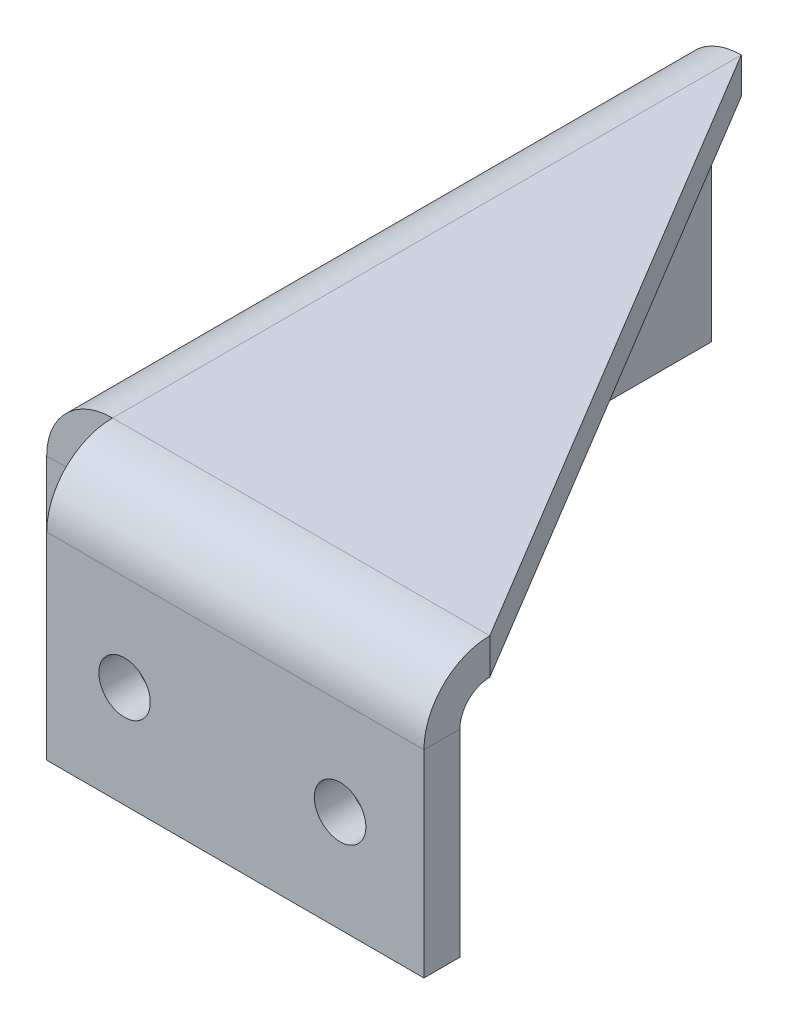
from build123d import *

# Parameters (mm, degrees)
SKETCH1_W            = 31.5
SKETCH1_H            = 52.5
BASE_FLANGE1_DEPTH   = 3
EDGE_FLANGE1_DEPTH   = 31.5
EDGE_FLANGE2_DEPTH   = 52.5
CUT_EXTRUDE1_DEPTH   = 10
M4_CLEARANCE_HOLE1_D = 4.3
M4_CLEARANCE_HOLE2_D = 4.3


# Sheet-metal steps are written as plain solids
with BuildPart() as part:
    # Sketch1 → Base-Flange1 (new body)
    with BuildSketch(Plane(origin=(0, 0, 0), x_dir=(1, 0, 0), z_dir=(0, 1, 0))):
        with Locations((-15.75, 26.25)):
            Rectangle(SKETCH1_W, SKETCH1_H)
    extrude(amount=-BASE_FLANGE1_DEPTH)

    # Edge-Flange1 section (across the edge) → Edge-Flange1 (add)
    with BuildSketch(Plane(origin=(0, -3, 2.5), x_dir=(0, 0, -1), z_dir=(-1, 0, 0))):
        with BuildLine():
            Line((-3, 2.5), (-3, 19))
            Line((-3, 19), (0, 19))
            Line((0, 19), (0, 2.5))
            ThreePointArc((0, 2.5), (0.732233047, 0.732233047), (2.5, 0))
            Line((2.5, 0), (2.5, -3))
            ThreePointArc((2.5, -3), (-1.389087297, -1.389087297), (-3, 2.5))
        make_face()
    extrude(amount=EDGE_FLANGE1_DEPTH)

    # Edge-Flange2 section (across the edge) → Edge-Flange2 (add)
    with BuildSketch(Plane(origin=(-34, -3, 0), x_dir=(1, 0, 0), z_dir=(0, 0, -1))):
        with BuildLine():
            Line((-3, 2.5), (-3, 19))
            Line((-3, 19), (0, 19))
            Line((0, 19), (0, 2.5))
            ThreePointArc((0, 2.5), (0.732233047, 0.732233047), (2.5, 0))
            Line((2.5, 0), (2.5, -3))
            ThreePointArc((2.5, -3), (-1.389087297, -1.389087297), (-3, 2.5))
        make_face()
    extrude(amount=EDGE_FLANGE2_DEPTH)

    # Sketch12 → Cut-Extrude1 (cut)
    with BuildSketch(Plane(origin=(0, 0, 0), x_dir=(1, 0, 0), z_dir=(0, 1, 0))):
        Polygon((-31.5, 52.5), (0, 0), (0, 52.5), align=None)
    extrude(amount=-CUT_EXTRUDE1_DEPTH, mode=Mode.SUBTRACT)

    # M4 Clearance Hole1 (through all)
    with Locations(Plane(origin=(0, 0, 2.5), x_dir=(-1, 0, 0), z_dir=(0, 0, -1))):
        with Locations((7, -13.5), (25, -13.5)):
            Hole(M4_CLEARANCE_HOLE1_D / 2)

    # M4 Clearance Hole2 (through all)
    with Locations(Plane(origin=(-34, 0, 0), x_dir=(0, 0, -1), z_dir=(1, 0, 0))):
        with Locations((44.5, -13.5), (8.5, -13.5)):
            Hole(M4_CLEARANCE_HOLE2_D / 2)


solid = part.part
